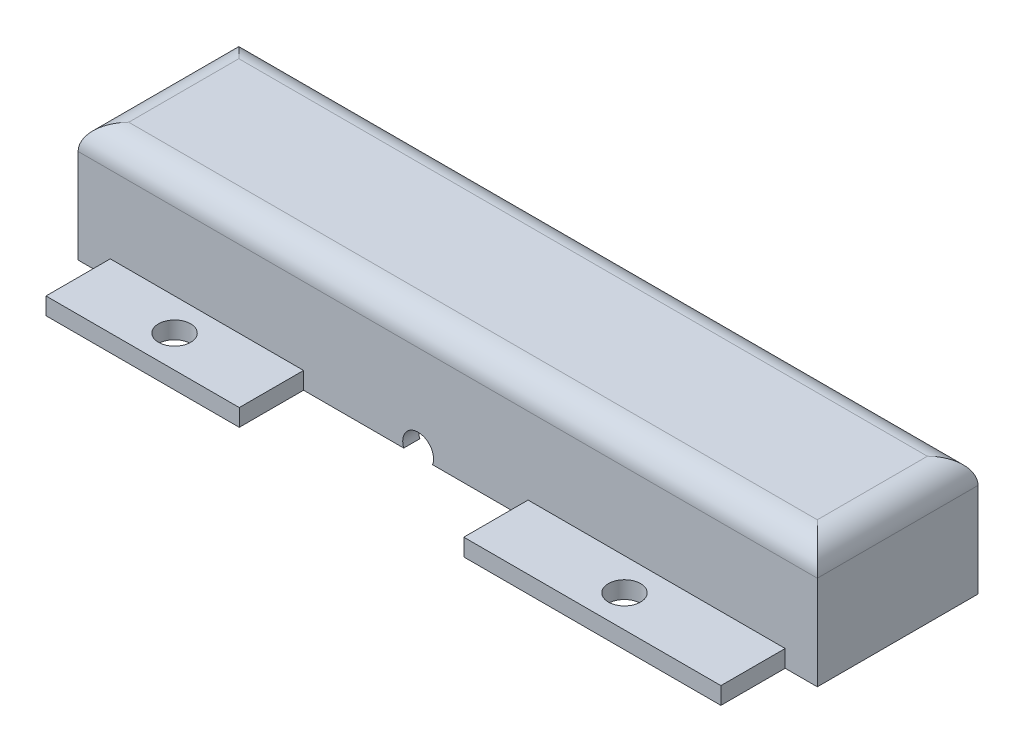
from build123d import *

# Parameters (mm, degrees)
SKETCH1_W           = 146.05
SKETCH1_H           = 23.59
BOSS_EXTRUDE1_DEPTH = 31.75
SKETCH2_W           = 139.69
SKETCH2_H           = 25.39
CUT_EXTRUDE1_DEPTH  = 21
FILLET1_R           = 5
SKETCH3_R           = 3.05
CUT_EXTRUDE2_DEPTH  = 3.18
SKETCH4_W           = 38.19
SKETCH4_H           = 3.39
SKETCH4_W_2         = 50.8
BOSS_EXTRUDE2_DEPTH = 12.7
SKETCH5_W           = 25.4
SKETCH5_H           = 3.39
BOSS_EXTRUDE3_DEPTH = 12.7
SKETCH6_R           = 3.175
CUT_EXTRUDE3_DEPTH  = 12.7
SKETCH7_R           = 3.175
CUT_EXTRUDE4_DEPTH  = 12.7


with BuildPart() as part:
    # Sketch1 → Boss-Extrude1 (new body)
    with BuildSketch(Plane.XY):
        with Locations((25.404065421, 11.795)):
            Rectangle(SKETCH1_W, SKETCH1_H)
    extrude(amount=BOSS_EXTRUDE1_DEPTH)

    # Sketch2 → Cut-Extrude1 (cut)
    with BuildSketch(Plane.XZ):
        with Locations((25.404065421, 15.875)):
            Rectangle(SKETCH2_W, SKETCH2_H)
    extrude(amount=-CUT_EXTRUDE1_DEPTH, mode=Mode.SUBTRACT)

    # Fillet1
    fillet1_edges = [part.edges().sort_by_distance(p)[0] for p in [
        (98.429065421, 23.59, 15.875),
        (25.404065421, 23.59, 31.75),
        (-47.620934579, 23.59, 15.875),
        (25.404065421, 23.59, 0),
    ]]
    fillet(fillet1_edges, radius=FILLET1_R)

    # Sketch3 → Cut-Extrude2 (cut)
    with BuildSketch(Plane.XY.offset(31.75)):
        with Locations((19.559065421, 1.09)):
            Circle(SKETCH3_R)
    extrude(amount=-CUT_EXTRUDE2_DEPTH, mode=Mode.SUBTRACT)

    # Sketch4 → Boss-Extrude2 (add)
    with BuildSketch(Plane.XY.offset(31.75)):
        with Locations((-22.175934579, 1.695)):
            Rectangle(SKETCH4_W, SKETCH4_H)
        with Locations((66.679065421, 1.695)):
            Rectangle(SKETCH4_W_2, SKETCH4_H)
    extrude(amount=BOSS_EXTRUDE2_DEPTH)

    # Sketch5 → Boss-Extrude3 (add)
    with BuildSketch(Plane(origin=(0, 0, 0), x_dir=(-1, 0, 0), z_dir=(0, 0, -1))):
        with Locations((-25.729065421, 1.695)):
            Rectangle(SKETCH5_W, SKETCH5_H)
    extrude(amount=BOSS_EXTRUDE3_DEPTH)

    # Sketch6 → Cut-Extrude3 (cut)
    with BuildSketch(Plane(origin=(0, 3.39, 0), x_dir=(1, 0, 0), z_dir=(0, 1, 0))):
        with Locations((-22.220934579, -38.1)):
            Circle(SKETCH6_R)
        with Locations((66.679065421, -38.1)):
            Circle(SKETCH6_R)
    extrude(amount=-CUT_EXTRUDE3_DEPTH, mode=Mode.SUBTRACT)

    # Sketch7 → Cut-Extrude4 (cut)
    with BuildSketch(Plane(origin=(0, 3.39, 0), x_dir=(1, 0, 0), z_dir=(0, 1, 0))):
        with Locations((25.729065421, 6.35)):
            Circle(SKETCH7_R)
    extrude(amount=-CUT_EXTRUDE4_DEPTH, mode=Mode.SUBTRACT)


solid = part.part
